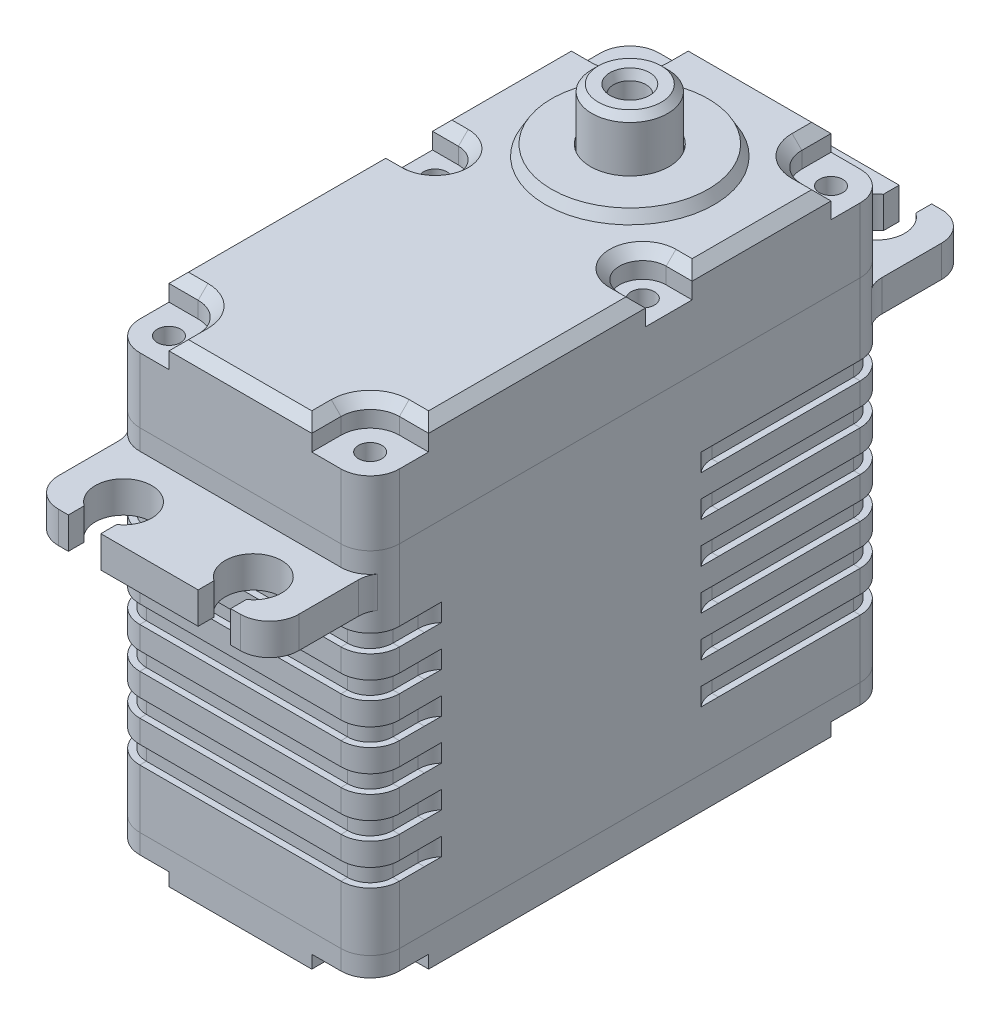
from build123d import *

# Parameters (mm, degrees)
BOSS_EXTRUDE1_DEPTH           = 11
BOSS_EXTRUDE1_DEPTH_BACK      = 26
BOSS_EXTRUDE2_DEPTH           = 2.43
FILLET1_R                     = 2
CUT_EXTRUDE1_DEPTH            = 2.43
SKETCH5_OUTSIDE_W             = 36.232
SKETCH5_OUTSIDE_H             = 70.232
CUT_EXTRUDE2_DEPTH            = 2
CUT_EXTRUDE3_DEPTH            = 1.5
CHAMFER1_SIZE                 = 0.75
CHAMFER2_SIZE                 = 0.5
SKETCH10_R                    = 0.9
CUT_EXTRUDE4_DEPTH            = 5
CUT_EXTRUDE5_START            = -1.5
SKETCH11_R                    = 0.9
CUT_EXTRUDE5_DEPTH            = 1.5
M3_TAPPED_HOLE1_D             = 2.5
M3_TAPPED_HOLE1_DEPTH         = 8.5
M3_TAPPED_HOLE1_CSINK_D       = 3.05
M3_TAPPED_HOLE1_CSINK_ANGLE   = 45
M3_TAPPED_HOLE1_TIP           = 0.751075774
M1_6_TAPPED_HOLE1_D           = 1.25
M1_6_TAPPED_HOLE1_DEPTH       = 11.95
M1_6_TAPPED_HOLE1_CSINK_D     = 1.65
M1_6_TAPPED_HOLE1_CSINK_ANGLE = 45
M1_6_TAPPED_HOLE1_TIP         = 0.375537887
M1_6_TAPPED_HOLE2_D           = 1.25
M1_6_TAPPED_HOLE2_DEPTH       = 6.95
M1_6_TAPPED_HOLE2_CSINK_D     = 1.65
M1_6_TAPPED_HOLE2_CSINK_ANGLE = 45
M1_6_TAPPED_HOLE2_TIP         = 0.375537887
BOSS_EXTRUDE3_DEPTH           = 1
BOSS_EXTRUDE4_DEPTH           = 3
BOSS_EXTRUDE4_TAPER           = 5
SKETCH20_R                    = 0.75
BOSS_EXTRUDE5_DEPTH           = 0.5
FILLET2_R                     = 0.25


with BuildPart() as part:
    # Sketch1 → Boss-Extrude1 (new, two sides: drawn at the far end of the back side and taken through both)
    with BuildSketch(Plane(origin=(0, 0, 0), x_dir=(1, 0, 0), z_dir=(0, 1, 0)).offset(-BOSS_EXTRUDE1_DEPTH_BACK)):
        with BuildLine():
            Line((-7.75, 20), (7.75, 20))
            ThreePointArc((7.75, 20), (9.340990258, 19.340990258), (10, 17.75))
            Line((10, 17.75), (10, -17.75))
            ThreePointArc((10, -17.75), (9.340990258, -19.340990258), (7.75, -20))
            Line((7.75, -20), (-7.75, -20))
            ThreePointArc((-7.75, -20), (-9.340990258, -19.340990258), (-10, -17.75))
            Line((-10, -17.75), (-10, 17.75))
            ThreePointArc((-10, 17.75), (-9.340990258, 19.340990258), (-7.75, 20))
        make_face()
    extrude(amount=BOSS_EXTRUDE1_DEPTH + BOSS_EXTRUDE1_DEPTH_BACK)

    # Sketch2 → Boss-Extrude2 (add)
    with BuildSketch(Plane(origin=(0, 0, 0), x_dir=(1, 0, 0), z_dir=(0, 1, 0))):
        with BuildLine():
            Line((-7, 27), (7, 27))
            ThreePointArc((7, 27), (8.590990258, 26.340990258), (9.25, 24.75))
            Line((9.25, 24.75), (9.25, -24.75))
            ThreePointArc((9.25, -24.75), (8.590990258, -26.340990258), (7, -27))
            Line((7, -27), (-7, -27))
            ThreePointArc((-7, -27), (-8.590990258, -26.340990258), (-9.25, -24.75))
            Line((-9.25, -24.75), (-9.25, 24.75))
            ThreePointArc((-9.25, 24.75), (-8.590990258, 26.340990258), (-7, 27))
        make_face()
    extrude(amount=BOSS_EXTRUDE2_DEPTH)

    # Fillet1
    fillet1_edges = [part.edges().sort_by_distance(p)[0] for p in [
        (9.25, 1.215, 19.427050983),
        (-9.25, 1.215, -19.427050983),
        (-9.25, 1.215, 19.427050983),
        (9.25, 1.215, -19.427050983),
    ]]
    fillet(fillet1_edges, radius=FILLET1_R)

    # Sketch3 → Cut-Extrude1 (cut)
    with BuildSketch(Plane(origin=(0, 2.43, 0), x_dir=(1, 0, 0), z_dir=(0, 1, 0))):
        with BuildLine():
            Line((-6.25, -25.779922751), (-6.25, -27))
            Line((-6.25, -27), (-3.75, -27))
            Line((-3.75, -27), (-3.75, -25.779922751))
            ThreePointArc((-3.75, -25.779922751), (-5, -21.825), (-6.25, -25.779922751))
        make_face()
        with BuildLine():
            Line((3.75, -27), (3.75, -25.779922751))
            ThreePointArc((3.75, -25.779922751), (5, -21.825), (6.25, -25.779922751))
            Line((6.25, -25.779922751), (6.25, -27))
            Line((6.25, -27), (3.75, -27))
        make_face()
    cut_extrude1 = extrude(amount=-CUT_EXTRUDE1_DEPTH, mode=Mode.SUBTRACT)

    # Mirror1: Cut-Extrude1 across plane
    add(cut_extrude1.mirror(Plane.XY), mode=Mode.SUBTRACT)

    # Sketch4 → Revolve1 (revolve)
    with BuildSketch(Plane(origin=(0, 0, 0), x_dir=(0, 0, -1), z_dir=(1, 0, 0)), mode=Mode.PRIVATE) as revolve1_sk:
        Polygon((10, 15.8), (10, 11), (16.5, 11), (16.038119785, 11.8), (13.025, 11.8), (13.025, 11.2), (12.925, 11.2), (12.925, 15.3), (12.425, 15.8), align=None)
    revolve(revolve1_sk.sketch.rotate(Axis((0, 23.34239381, -10), (0, -1, 0)), 180), axis=Axis((0, 23.34239381, -10), (0, -1, 0)))

    # Sketch5 outside → Cut-Extrude2 (cut)
    with BuildSketch(Plane(origin=(0, 11, 0), x_dir=(1, 0, 0), z_dir=(0, 1, 0))):
        Rectangle(SKETCH5_OUTSIDE_W, SKETCH5_OUTSIDE_H)
        with BuildLine():
            Line((-5.5, 20), (5.5, 20))
            Line((5.5, 20), (5.5, 17.75))
            ThreePointArc((5.5, 17.75), (6.159009742, 16.159009742), (7.75, 15.5))
            Line((7.75, 15.5), (10, 15.5))
            Line((10, 15.5), (10, 4.8))
            Line((10, 4.8), (8, 4.8))
            ThreePointArc((8, 4.8), (6.2, 3), (8, 1.2))
            Line((8, 1.2), (10, 1.2))
            Line((10, 1.2), (10, -15.5))
            Line((10, -15.5), (7.75, -15.5))
            ThreePointArc((7.75, -15.5), (6.159009742, -16.159009742), (5.5, -17.75))
            Line((5.5, -17.75), (5.5, -20))
            Line((5.5, -20), (-5.5, -20))
            Line((-5.5, -20), (-5.5, -17.75))
            ThreePointArc((-5.5, -17.75), (-6.159009742, -16.159009742), (-7.75, -15.5))
            Line((-7.75, -15.5), (-10, -15.5))
            Line((-10, -15.5), (-10, 1.2))
            Line((-10, 1.2), (-8, 1.2))
            ThreePointArc((-8, 1.2), (-6.2, 3), (-8, 4.8))
            Line((-8, 4.8), (-10, 4.8))
            Line((-10, 4.8), (-10, 15.5))
            Line((-10, 15.5), (-7.75, 15.5))
            ThreePointArc((-7.75, 15.5), (-6.159009742, 16.159009742), (-5.5, 17.75))
            Line((-5.5, 17.75), (-5.5, 20))
        make_face(mode=Mode.SUBTRACT)
    extrude(amount=-CUT_EXTRUDE2_DEPTH, mode=Mode.SUBTRACT)

    # Sketch7 → Cut-Extrude3 (cut)
    with BuildSketch(Plane.XZ.offset(26)):
        with BuildLine():
            Line((7.75, 15.5), (10, 15.5))
            Line((10, 15.5), (10, 17.75))
            ThreePointArc((10, 17.75), (9.340990258, 19.340990258), (7.75, 20))
            Line((7.75, 20), (5.5, 20))
            Line((5.5, 20), (5.5, 17.75))
            ThreePointArc((5.5, 17.75), (6.159009742, 16.159009742), (7.75, 15.5))
        make_face()
        with BuildLine():
            Line((-5.5, 20), (-7.75, 20))
            ThreePointArc((-7.75, 20), (-9.340990258, 19.340990258), (-10, 17.75))
            Line((-10, 17.75), (-10, 15.5))
            Line((-10, 15.5), (-7.75, 15.5))
            ThreePointArc((-7.75, 15.5), (-6.159009742, 16.159009742), (-5.5, 17.75))
            Line((-5.5, 17.75), (-5.5, 20))
        make_face()
        with BuildLine():
            Line((-7.75, -15.5), (-10, -15.5))
            Line((-10, -15.5), (-10, -17.75))
            ThreePointArc((-10, -17.75), (-9.340990258, -19.340990258), (-7.75, -20))
            Line((-7.75, -20), (-5.5, -20))
            Line((-5.5, -20), (-5.5, -17.75))
            ThreePointArc((-5.5, -17.75), (-6.159009742, -16.159009742), (-7.75, -15.5))
        make_face()
        with BuildLine():
            Line((5.5, -17.75), (5.5, -20))
            Line((5.5, -20), (7.75, -20))
            ThreePointArc((7.75, -20), (9.340990258, -19.340990258), (10, -17.75))
            Line((10, -17.75), (10, -15.5))
            Line((10, -15.5), (7.75, -15.5))
            ThreePointArc((7.75, -15.5), (6.159009742, -16.159009742), (5.5, -17.75))
        make_face()
    extrude(amount=-CUT_EXTRUDE3_DEPTH, mode=Mode.SUBTRACT)

    # Cut-Sweep1: sweep along a path in Sketch8
    with BuildLine(Plane(origin=(0, -18.5, 0), x_dir=(-1, 0, 0), z_dir=(0, -1, 0))) as cut_sweep1_path:
        ThreePointArc((10, 14.5), (9.629171307, 15.115768874), (9.5, 15.822875656))
        Line((9.5, 15.822875656), (9.5, 17.75))
        ThreePointArc((9.5, 17.75), (8.987436867, 18.987436867), (7.75, 19.5))
        Line((7.75, 19.5), (-7.75, 19.5))
        ThreePointArc((-7.75, 19.5), (-8.987436867, 18.987436867), (-9.5, 17.75))
        Line((-9.5, 17.75), (-9.5, 6.822875656))
        ThreePointArc((-9.5, 6.822875656), (-9.629171307, 6.115768874), (-10, 5.5))
        ThreePointArc((-10, 5.5), (-13.77964473, -4.5), (-10, -14.5))
        ThreePointArc((-10, -14.5), (-9.629171307, -15.115768874), (-9.5, -15.822875656))
        Line((-9.5, -15.822875656), (-9.5, -17.75))
        ThreePointArc((-9.5, -17.75), (-8.987436867, -18.987436867), (-7.75, -19.5))
        Line((-7.75, -19.5), (7.75, -19.5))
        ThreePointArc((7.75, -19.5), (8.987436867, -18.987436867), (9.5, -17.75))
        Line((9.5, -17.75), (9.5, -6.822875656))
        ThreePointArc((9.5, -6.822875656), (9.629171307, -6.115768874), (10, -5.5))
    # Sketch9 → Cut-Sweep1 (sweep, cut)
    with BuildSketch(Plane(origin=(-10, -18.5, -14.5), x_dir=(0.7500000000000001, 0, 0.6614378277661477), z_dir=(-0.6614378277661476, 0, 0.75))):
        Polygon((0, 0), (-0.7, 0), (-0.7, 17), (0, 17), (0, 15.625), (-0.6, 15.625), (-0.6, 13.875), (0, 13.875), (0, 12.5), (-0.6, 12.5), (-0.6, 10.75), (0, 10.75), (0, 9.375), (-0.6, 9.375), (-0.6, 7.625), (0, 7.625), (0, 6.25), (-0.6, 6.25), (-0.6, 4.5), (0, 4.5), (0, 3.125), (-0.6, 3.125), (-0.6, 1.375), (0, 1.375), align=None)
    sweep(path=cut_sweep1_path.line, mode=Mode.SUBTRACT)

    # Chamfer1
    chamfer1_edges = [part.edges().sort_by_distance(p)[0] for p in [
        (0, 11, 20),
        (10, 11, 7.15),
        (10, 11, -10.15),
        (0, 11, -20),
        (-10, 11, -10.15),
        (-10, 11, 7.15),
        (5.5, 11, -18.875),
        (6.159009742, 11, -16.159009742),
        (8.875, 11, -15.5),
        (9, 11, -4.8),
        (6.2, 11, -3),
        (9, 11, -1.2),
        (8.875, 11, 15.5),
        (6.159009742, 11, 16.159009742),
        (5.5, 11, 18.875),
        (-5.5, 11, 18.875),
        (-6.159009742, 11, 16.159009742),
        (-8.875, 11, 15.5),
        (-9, 11, -1.2),
        (-6.2, 11, -3),
        (-9, 11, -4.8),
        (-8.875, 11, -15.5),
        (-6.159009742, 11, -16.159009742),
        (-5.5, 11, -18.875),
    ]]
    chamfer(chamfer1_edges, length=CHAMFER1_SIZE)

    # Chamfer2
    chamfer2_edges = [part.edges().sort_by_distance(p)[0] for p in [
        (10, -26, 0),
        (5.5, -26, 18.875),
        (6.159009742, -26, 16.159009742),
        (8.875, -26, 15.5),
        (-10, -26, 0),
        (-5.5, -26, -18.875),
        (-6.159009742, -26, -16.159009742),
        (-8.875, -26, -15.5),
        (0, -26, 20),
        (-8.875, -26, 15.5),
        (-6.159009742, -26, 16.159009742),
        (-5.5, -26, 18.875),
        (0, -26, -20),
        (8.875, -26, -15.5),
        (6.159009742, -26, -16.159009742),
        (5.5, -26, -18.875),
    ]]
    chamfer(chamfer2_edges, length=CHAMFER2_SIZE)

    # Sketch10 → Cut-Extrude4 (cut)
    with BuildSketch(Plane(origin=(0, 9, 0), x_dir=(1, 0, 0), z_dir=(0, 1, 0))):
        with Locations(Location((7.75, 17.75, 0), (0, 0, 270))):
            Circle(SKETCH10_R)
        with Locations(Location((-7.75, 17.75, 0), (0, 0, 270))):
            Circle(SKETCH10_R)
        with Locations(Location((-8, 3, 0), (0, 0, 270))):
            Circle(SKETCH10_R)
        with Locations(Location((8, 3, 0), (0, 0, 270))):
            Circle(SKETCH10_R)
        with Locations(Location((7.75, -17.75, 0), (0, 0, 270))):
            Circle(SKETCH10_R)
        with Locations(Location((-7.75, -17.75, 0), (0, 0, 270))):
            Circle(SKETCH10_R)
    extrude(amount=-CUT_EXTRUDE4_DEPTH, mode=Mode.SUBTRACT)

    # Sketch11 → Cut-Extrude5 (cut)
    with BuildSketch(Plane.XZ.offset(24.5).offset(CUT_EXTRUDE5_START)):
        with Locations(Location((7.75, 17.75, 0), (0, 0, 90))):
            Circle(SKETCH11_R)
        with Locations(Location((-7.75, 17.75, 0), (0, 0, 90))):
            Circle(SKETCH11_R)
        with Locations(Location((-7.75, -17.75, 0), (0, 0, 90))):
            Circle(SKETCH11_R)
        with Locations(Location((7.75, -17.75, 0), (0, 0, 90))):
            Circle(SKETCH11_R)
    extrude(amount=CUT_EXTRUDE5_DEPTH, mode=Mode.SUBTRACT)

    # M3 Tapped Hole1
    with Locations(Plane(origin=(0, 15.8, 0), x_dir=(1, 0, 0), z_dir=(0, 1, 0))):
        with Locations((0, 10)):
            CounterSinkHole(M3_TAPPED_HOLE1_D / 2, M3_TAPPED_HOLE1_CSINK_D / 2, depth=M3_TAPPED_HOLE1_DEPTH, counter_sink_angle=M3_TAPPED_HOLE1_CSINK_ANGLE)
            with Locations((0, 0, -(M3_TAPPED_HOLE1_DEPTH + M3_TAPPED_HOLE1_TIP / 2))):  # 118° drill point
                Cone(0, M3_TAPPED_HOLE1_D / 2, M3_TAPPED_HOLE1_TIP, mode=Mode.SUBTRACT)

    # M1.6 Tapped Hole1
    with Locations(Plane(origin=(0, 4, 0), x_dir=(1, 0, 0), z_dir=(0, 1, 0))):
        with Locations((-7.75, 17.75), (7.75, 17.75), (8, 3), (-8, 3), (-7.75, -17.75), (7.75, -17.75)):
            CounterSinkHole(M1_6_TAPPED_HOLE1_D / 2, M1_6_TAPPED_HOLE1_CSINK_D / 2, depth=M1_6_TAPPED_HOLE1_DEPTH, counter_sink_angle=M1_6_TAPPED_HOLE1_CSINK_ANGLE)
            with Locations((0, 0, -(M1_6_TAPPED_HOLE1_DEPTH + M1_6_TAPPED_HOLE1_TIP / 2))):  # 118° drill point
                Cone(0, M1_6_TAPPED_HOLE1_D / 2, M1_6_TAPPED_HOLE1_TIP, mode=Mode.SUBTRACT)

    # M1.6 Tapped Hole2
    with Locations(Plane(origin=(0, -23, 0), x_dir=(-1, 0, 0), z_dir=(0, -1, 0))):
        with Locations((-7.75, 17.75), (7.75, 17.75), (-7.75, -17.75), (7.75, -17.75)):
            CounterSinkHole(M1_6_TAPPED_HOLE2_D / 2, M1_6_TAPPED_HOLE2_CSINK_D / 2, depth=M1_6_TAPPED_HOLE2_DEPTH, counter_sink_angle=M1_6_TAPPED_HOLE2_CSINK_ANGLE)
            with Locations((0, 0, -(M1_6_TAPPED_HOLE2_DEPTH + M1_6_TAPPED_HOLE2_TIP / 2))):  # 118° drill point
                Cone(0, M1_6_TAPPED_HOLE2_D / 2, M1_6_TAPPED_HOLE2_TIP, mode=Mode.SUBTRACT)

    # Sketch18 → Boss-Extrude3 (add)
    with BuildSketch(Plane(origin=(0, 0, -20), x_dir=(-1, 0, 0), z_dir=(0, 0, -1))):
        with BuildLine():
            Line((-3.15, -19.2), (3.15, -19.2))
            ThreePointArc((3.15, -19.2), (3.503553391, -19.346446609), (3.65, -19.7))
            Line((3.65, -19.7), (3.65, -23.7))
            ThreePointArc((3.65, -23.7), (3.503553391, -24.053553391), (3.15, -24.2))
            Line((3.15, -24.2), (-3.15, -24.2))
            ThreePointArc((-3.15, -24.2), (-3.503553391, -24.053553391), (-3.65, -23.7))
            Line((-3.65, -23.7), (-3.65, -19.7))
            ThreePointArc((-3.65, -19.7), (-3.503553391, -19.346446609), (-3.15, -19.2))
        make_face()
    extrude(amount=BOSS_EXTRUDE3_DEPTH)

    # Sketch19 → Boss-Extrude4 (add)
    with BuildSketch(Plane(origin=(0, 0, -21), x_dir=(-1, 0, 0), z_dir=(0, 0, -1))):
        with BuildLine():
            ThreePointArc((-1.575, -20.325), (-2.494238816, -20.705761184), (-2.875, -21.625))
            Line((-2.875, -21.625), (-2.875, -21.775))
            ThreePointArc((-2.875, -21.775), (-2.494238816, -22.694238816), (-1.575, -23.075))
            Line((-1.575, -23.075), (1.575, -23.075))
            ThreePointArc((1.575, -23.075), (2.494238816, -22.694238816), (2.875, -21.775))
            Line((2.875, -21.775), (2.875, -21.625))
            ThreePointArc((2.875, -21.625), (2.494238816, -20.705761184), (1.575, -20.325))
            Line((1.575, -20.325), (-1.575, -20.325))
        make_face()
    extrude(amount=BOSS_EXTRUDE4_DEPTH, taper=BOSS_EXTRUDE4_TAPER)

    # Sketch20 → Boss-Extrude5 (add)
    with BuildSketch(Plane(origin=(0, 0, -24), x_dir=(-1, 0, 0), z_dir=(0, 0, -1))):
        with Locations(Location((-1.525, -21.7, 0), (0, 0, 180))):
            Circle(SKETCH20_R)
        with Locations(Location((1.525, -21.7, 0), (0, 0, 180))):
            Circle(SKETCH20_R)
        with Locations(Location((0, -21.7, 0), (0, 0, 180))):
            Circle(SKETCH20_R)
    extrude(amount=BOSS_EXTRUDE5_DEPTH)

    # Fillet2
    fillet2_edges = [part.edges().sort_by_distance(p)[0] for p in [
        (3.503553391, -24.053553391, -21),
        (0, -24.2, -21),
        (-3.503553391, -24.053553391, -21),
        (-3.65, -21.7, -21),
        (-3.503553391, -19.346446609, -21),
        (0, -19.2, -21),
        (3.503553391, -19.346446609, -21),
        (3.65, -21.7, -21),
        (-2.494238816, -20.705761184, -21),
        (0, -20.325, -21),
        (2.494238816, -20.705761184, -21),
        (2.875, -21.7, -21),
        (2.494238816, -22.694238816, -21),
        (0, -23.075, -21),
        (-2.494238816, -22.694238816, -21),
        (-2.875, -21.7, -21),
        (-2.308647334, -20.891352666, -24),
        (0, -20.587465991, -24),
        (2.308647334, -20.891352666, -24),
        (2.612534009, -21.7, -24),
        (2.308647334, -22.508647334, -24),
        (0, -22.812534009, -24),
        (-2.308647334, -22.508647334, -24),
        (-2.612534009, -21.7, -24),
    ]]
    fillet(fillet2_edges, radius=FILLET2_R)


solid = part.part
